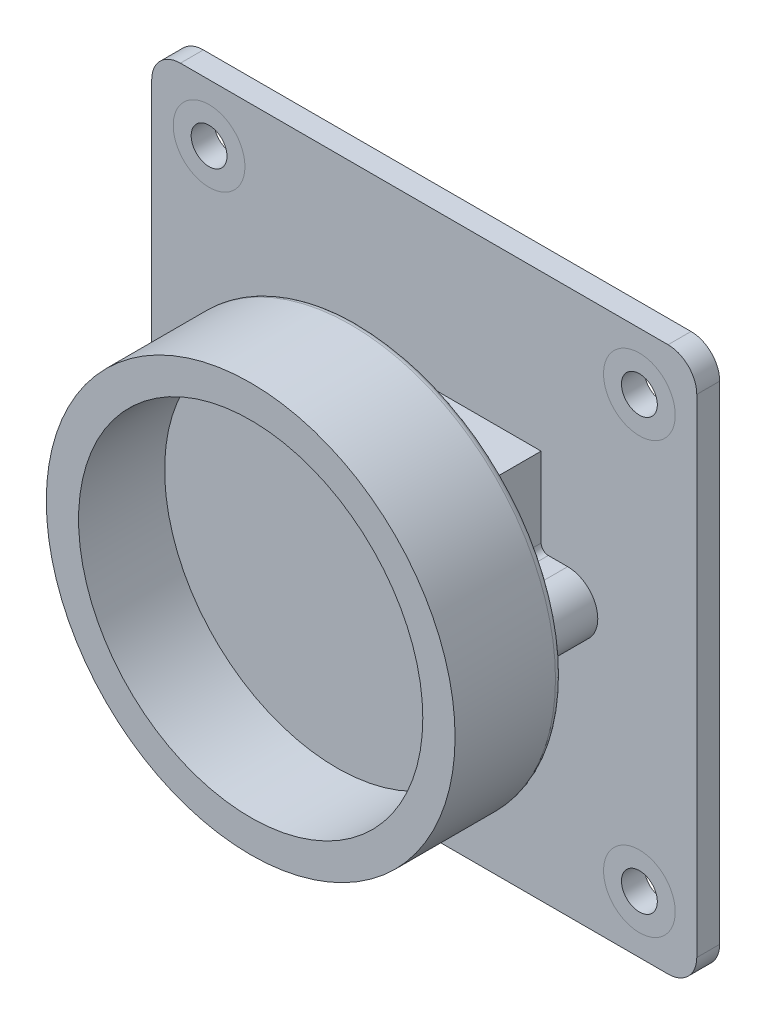
from build123d import *

# Parameters (mm, degrees)
SKETCH1_W             = 38
SKETCH1_H             = 38
BOSS_EXTRUDE1_DEPTH   = 1.6
SKETCH2_R             = 1.25
CUT_EXTRUDE1_DEPTH    = 27.917652201
FILLET1_R             = 2
SKETCH3_R             = 2.1
SKETCH3_W             = 16.3
SKETCH3_H             = 16.3
SKETCH3_W_2           = 20
SKETCH3_H_2           = 4.2
BOSS_EXTRUDE2_DEPTH   = 4.6
SKETCH4_R             = 14.25
BOSS_EXTRUDE3_DEPTH   = 7.5
SKETCH5_R             = 12
CUT_EXTRUDE2_DEPTH    = 6
FILLET2_R             = 0.5
SKETCH6_R             = 1.75
BOSS_EXTRUDE4_DEPTH   = 1
BOSS_EXTRUDE4_2_DEPTH = 1
FILLET3_R             = 0.8
FILLET4_R             = 0.8


with BuildPart() as part:
    # Sketch1 → Boss-Extrude1 (new body)
    with BuildSketch(Plane.XY):
        Rectangle(SKETCH1_W, SKETCH1_H)
    extrude(amount=BOSS_EXTRUDE1_DEPTH)

    # Sketch2 → Cut-Extrude1 (cut, through all)
    with BuildSketch(Plane.XY.offset(1.6)):
        with Locations((-15, 15)):
            Circle(SKETCH2_R)
        with Locations((15, 15)):
            Circle(SKETCH2_R)
        with Locations((15, -15)):
            Circle(SKETCH2_R)
        with Locations((-15, -15)):
            Circle(SKETCH2_R)
    extrude(amount=-CUT_EXTRUDE1_DEPTH, mode=Mode.SUBTRACT)

    # Fillet1
    fillet1_edges = [part.edges().sort_by_distance(p)[0] for p in [
        (-19, -19, 0.8),
        (19, -19, 0.8),
        (19, 19, 0.8),
        (-19, 19, 0.8),
    ]]
    fillet(fillet1_edges, radius=FILLET1_R)


with BuildPart() as body_2:
    # Sketch3 → Boss-Extrude2 (new body)
    with BuildSketch(Plane.XY.offset(1.6)):
        with Locations((10, 0)):
            Circle(SKETCH3_R)
        with Locations((-10, 0)):
            Circle(SKETCH3_R)
        Rectangle(SKETCH3_W, SKETCH3_H)
        Rectangle(SKETCH3_W_2, SKETCH3_H_2)
    extrude(amount=BOSS_EXTRUDE2_DEPTH)

    # Sketch4 → Boss-Extrude3 (add)
    with BuildSketch(Plane.XY.offset(6.2)):
        Circle(SKETCH4_R)
    extrude(amount=BOSS_EXTRUDE3_DEPTH)

    # Sketch5 → Cut-Extrude2 (cut)
    with BuildSketch(Plane.XY.offset(13.7)):
        Circle(SKETCH5_R)
    extrude(amount=-CUT_EXTRUDE2_DEPTH, mode=Mode.SUBTRACT)

    # Fillet2
    fillet2_edges = [body_2.edges().sort_by_distance(p)[0] for p in [
        (-8.15, 2.1, 3.9),
        (-8.15, -2.1, 3.9),
        (8.15, -2.1, 3.9),
        (8.15, 2.1, 3.9),
        (-14.25, 0, 6.2),
    ]]
    fillet(fillet2_edges, radius=FILLET2_R)


with BuildPart() as body_3:
    # Sketch6 → Boss-Extrude4 (new body)
    with BuildSketch(Plane(origin=(0, 0, 0), x_dir=(-1, 0, 0), z_dir=(0, 0, -1))):
        with Locations((-10, 0)):
            Circle(SKETCH6_R)
    extrude(amount=BOSS_EXTRUDE4_DEPTH)

    # Fillet3
    fillet3_edges = [body_3.edges().sort_by_distance(p)[0] for p in [
        (11.75, 0, -1),
    ]]
    fillet(fillet3_edges, radius=FILLET3_R)


with BuildPart() as body_4:
    # Sketch6 → Boss-Extrude4 2 (new body)
    with BuildSketch(Plane(origin=(0, 0, 0), x_dir=(-1, 0, 0), z_dir=(0, 0, -1))):
        with Locations((10, 0)):
            Circle(SKETCH6_R)
    extrude(amount=BOSS_EXTRUDE4_2_DEPTH)

    # Fillet4
    fillet4_edges = [body_4.edges().sort_by_distance(p)[0] for p in [
        (-8.25, 0, -1),
    ]]
    fillet(fillet4_edges, radius=FILLET4_R)


solid = Compound([part.part, body_2.part, body_3.part, body_4.part])
